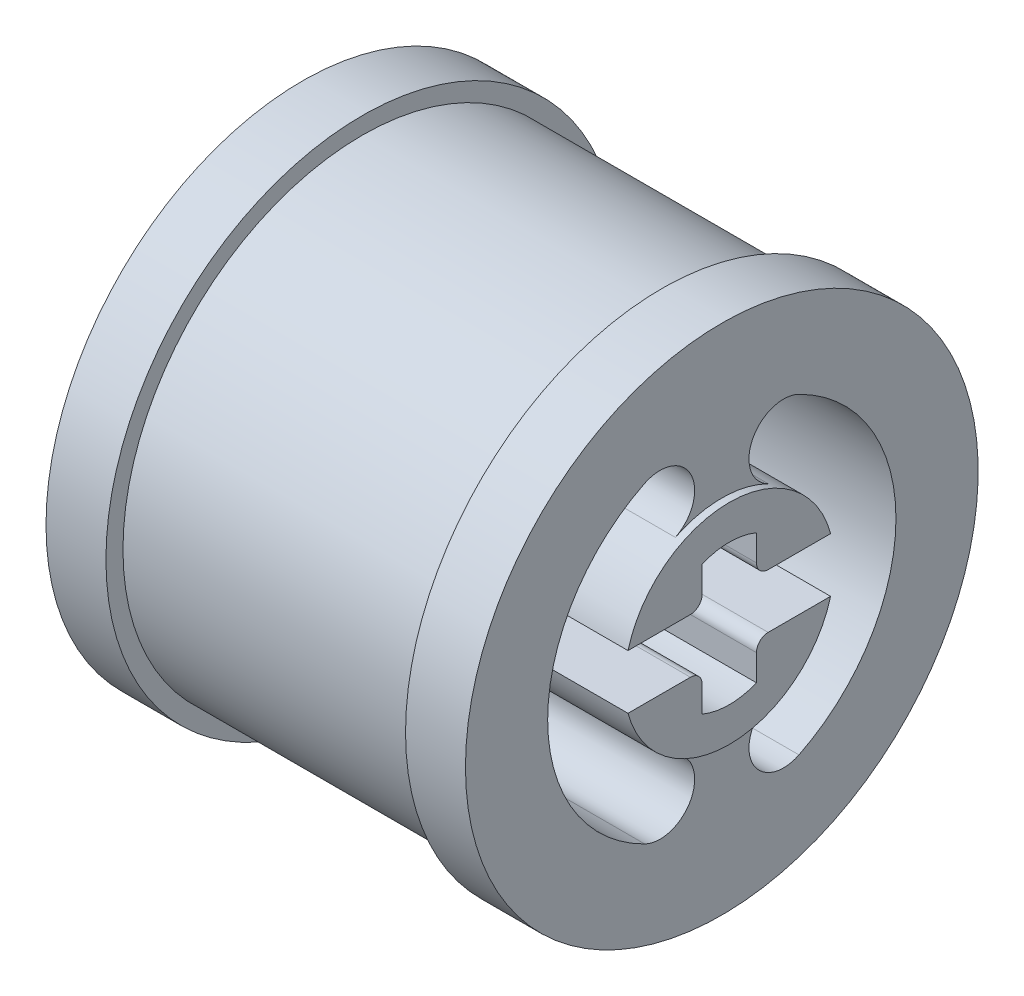
from build123d import *
from build123d.topology import SkipClean

# Parameters (mm, degrees)
SKETCH2_R           = 3.556
BOSS_EXTRUDE1_DEPTH = 0.254
CUT_EXTRUDE1_DEPTH  = 15.202896108
CUT_EXTRUDE2_DEPTH  = 15.331771344
FILLET1_R           = 0.396875


with BuildPart() as part:
    # Sketch1 → Base-Revolve (revolve)
    with BuildSketch(Plane.XY):
        Polygon((7.112, 0), (7.112, 8.69315), (5.08, 8.69315), (5.08, 8.1153), (3.556, 8.1153), (0, 8.1153), (0, 0), align=None)
    revolve(axis=Axis((0, 0, 0), (1, 0, 0)))

    # Sketch2 → Boss-Extrude1 (add)
    with BuildSketch(Plane(origin=(7.112, 0, 0), x_dir=(0, 0, -1), z_dir=(1, 0, 0))):
        Circle(SKETCH2_R)
    extrude(amount=BOSS_EXTRUDE1_DEPTH)

    # Sketch3 → Cut-Extrude1 (cut, through all)
    with SkipClean():  # the faces are left unmerged after this step: merging them gives an invalid solid
        with BuildSketch(Plane(origin=(7.112, 0, 0), x_dir=(0, 0, -1), z_dir=(1, 0, 0))):
            with BuildLine():
                ThreePointArc((2.61585906, -5.29454546), (5.9055, 0), (2.61585906, 5.29454546))
                ThreePointArc((2.61585906, 5.29454546), (1.042283968, 4.761688488), (1.57514094, 3.188113395))
                ThreePointArc((1.57514094, 3.188113395), (3.556, 0), (1.57514094, -3.188113395))
                ThreePointArc((1.57514094, -3.188113395), (1.042283968, -4.761688488), (2.61585906, -5.29454546))
            make_face()
            with BuildLine():
                ThreePointArc((-2.61585906, -5.29454546), (-1.042283968, -4.761688488), (-1.57514094, -3.188113395))
                ThreePointArc((-1.57514094, -3.188113395), (-3.556, 0), (-1.57514094, 3.188113395))
                ThreePointArc((-1.57514094, 3.188113395), (-1.042283968, 4.761688488), (-2.61585906, 5.29454546))
                ThreePointArc((-2.61585906, 5.29454546), (-5.9055, 0), (-2.61585906, -5.29454546))
            make_face()
        extrude(amount=-CUT_EXTRUDE1_DEPTH, mode=Mode.SUBTRACT)

    # Sketch4 → Cut-Extrude2 (cut, through all)
    with SkipClean():  # the faces are left unmerged after this step: merging them gives an invalid solid
        with BuildSketch(Plane(origin=(7.366, 0, 0), x_dir=(0, 0, -1), z_dir=(1, 0, 0))):
            with BuildLine():
                Line((3.434727855, 0.92075), (0.92075, 0.92075))
                Line((0.92075, 0.92075), (0.92075, 2.202919244))
                ThreePointArc((0.92075, 2.202919244), (0, 2.3876), (-0.92075, 2.202919244))
                Line((-0.92075, 2.202919244), (-0.92075, 0.92075))
                Line((-0.92075, 0.92075), (-3.434727855, 0.92075))
                ThreePointArc((-3.434727855, 0.92075), (-3.556, 0), (-3.434727855, -0.92075))
                Line((-3.434727855, -0.92075), (-0.92075, -0.92075))
                Line((-0.92075, -0.92075), (-0.92075, -2.202919244))
                ThreePointArc((-0.92075, -2.202919244), (0, -2.3876), (0.92075, -2.202919244))
                Line((0.92075, -2.202919244), (0.92075, -0.92075))
                Line((0.92075, -0.92075), (3.434727855, -0.92075))
                ThreePointArc((3.434727855, -0.92075), (3.556, 0), (3.434727855, 0.92075))
            make_face()
        extrude(amount=-CUT_EXTRUDE2_DEPTH, mode=Mode.SUBTRACT)

    # Fillet1
    fillet1_edges = [part.edges().sort_by_distance(p)[0] for p in [
        (3.683, 0.92075, -0.92075),
        (3.683, 0.92075, 0.92075),
        (3.683, -0.92075, 0.92075),
        (3.683, -0.92075, -0.92075),
    ]]
    fillet(fillet1_edges, radius=FILLET1_R)

    # Boss-Mirror1: part across plane


with BuildPart() as part_1:
    add(part.part)
    add(part.part.mirror(Plane(origin=(0, 8.1153, 0), x_dir=(0, 0, 1), z_dir=(1, 0, 0))))


solid = part_1.part
